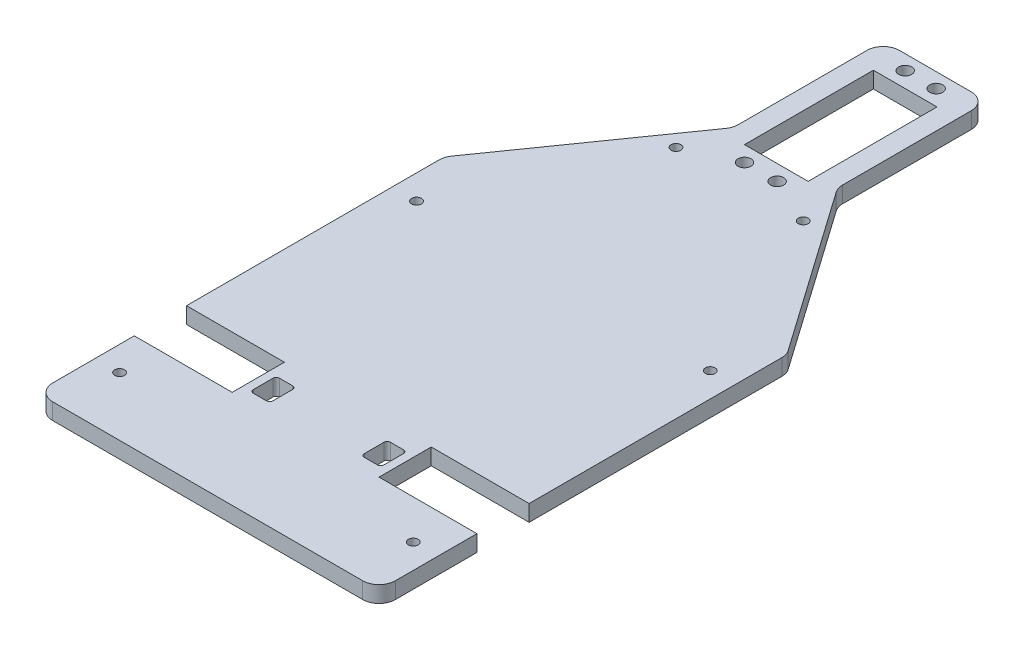
from build123d import *

# Parameters (mm, degrees)
BOSS_EXTRUDE1_DEPTH = 5
SKETCH2_R           = 2
SKETCH2_R_2         = 1.5
SKETCH2_W           = 19.5
SKETCH2_H           = 39.5
SKETCH2_W_2         = 30
SKETCH2_H_2         = 16
SKETCH2_W_3         = 6
SKETCH2_H_3         = 8
CUT_EXTRUDE1_DEPTH  = 7
FILLET1_R           = 5
FILLET2_R           = 5
FILLET3_R           = 5
FILLET4_R           = 5
FILLET5_R           = 5
FILLET6_R           = 5
FILLET8_R           = 1
FILLET9_R           = 1
FILLET10_R          = 5


with BuildPart() as part:
    # Sketch1 → Boss-Extrude1 (new body)
    with BuildSketch(Plane(origin=(0, 0, 0), x_dir=(1, 0, 0), z_dir=(0, 1, 0))):
        Polygon((-16, 108), (16, 108), (16, 62), (52.5, 10), (52.5, -115), (-52.5, -115), (-52.5, 10), (-16, 62), align=None)
    extrude(amount=BOSS_EXTRUDE1_DEPTH)

    # Sketch2 → Cut-Extrude1 (cut)
    with BuildSketch(Plane(origin=(0, 5, 0), x_dir=(1, 0, 0), z_dir=(0, 1, 0))):
        with Locations((-4.75, 103.5)):
            Circle(SKETCH2_R)
        with Locations((4.75, 103.5)):
            Circle(SKETCH2_R)
        with Locations((-5, 54.500637759)):
            Circle(SKETCH2_R)
        with Locations((5, 54.500637759)):
            Circle(SKETCH2_R)
        with Locations((-19.5, 48)):
            Circle(SKETCH2_R_2)
        with Locations((19.5, 48)):
            Circle(SKETCH2_R_2)
        with Locations((45, -6)):
            Circle(SKETCH2_R_2)
        with Locations((-45, -6)):
            Circle(SKETCH2_R_2)
        with Locations((45, -97)):
            Circle(SKETCH2_R_2)
        with Locations((-45, -97)):
            Circle(SKETCH2_R_2)
        with Locations((0, 79)):
            Rectangle(SKETCH2_W, SKETCH2_H)
        with Locations((-37.5, -77)):
            Rectangle(SKETCH2_W_2, SKETCH2_H_2)
        with Locations((37.5, -77)):
            Rectangle(SKETCH2_W_2, SKETCH2_H_2)
        with Locations((-17, -78)):
            Rectangle(SKETCH2_W_3, SKETCH2_H_3)
        with Locations((17, -78)):
            Rectangle(SKETCH2_W_3, SKETCH2_H_3)
    extrude(amount=-CUT_EXTRUDE1_DEPTH, mode=Mode.SUBTRACT)

    # Fillet1
    fillet1_edges = [part.edges().sort_by_distance(p)[0] for p in [
        (16, 2.5, -108),
    ]]
    fillet(fillet1_edges, radius=FILLET1_R)

    # Fillet2
    fillet2_edges = [part.edges().sort_by_distance(p)[0] for p in [
        (-16, 2.5, -108),
    ]]
    fillet(fillet2_edges, radius=FILLET2_R)

    # Fillet3
    fillet3_edges = [part.edges().sort_by_distance(p)[0] for p in [
        (52.5, 2.5, -10),
    ]]
    fillet(fillet3_edges, radius=FILLET3_R)

    # Fillet4
    fillet4_edges = [part.edges().sort_by_distance(p)[0] for p in [
        (-52.5, 2.5, -10),
    ]]
    fillet(fillet4_edges, radius=FILLET4_R)

    # Fillet5
    fillet5_edges = [part.edges().sort_by_distance(p)[0] for p in [
        (52.5, 2.5, 115),
    ]]
    fillet(fillet5_edges, radius=FILLET5_R)

    # Fillet6
    fillet6_edges = [part.edges().sort_by_distance(p)[0] for p in [
        (-52.5, 2.5, 115),
    ]]
    fillet(fillet6_edges, radius=FILLET6_R)

    # Fillet8
    fillet8_edges = [part.edges().sort_by_distance(p)[0] for p in [
        (20, 2.5, 74),
    ]]
    fillet(fillet8_edges, radius=FILLET8_R)

    # Fillet9
    fillet9_edges = [part.edges().sort_by_distance(p)[0] for p in [
        (-20, 2.5, 82),
        (-20, 2.5, 74),
        (-14, 2.5, 82),
        (-14, 2.5, 74),
        (14, 2.5, 82),
        (20, 2.5, 82),
        (14, 2.5, 74),
    ]]
    fillet(fillet9_edges, radius=FILLET9_R)

    # Fillet10
    fillet10_edges = [part.edges().sort_by_distance(p)[0] for p in [
        (-16, 2.5, -62),
        (16, 2.5, -62),
    ]]
    fillet(fillet10_edges, radius=FILLET10_R)


solid = part.part
